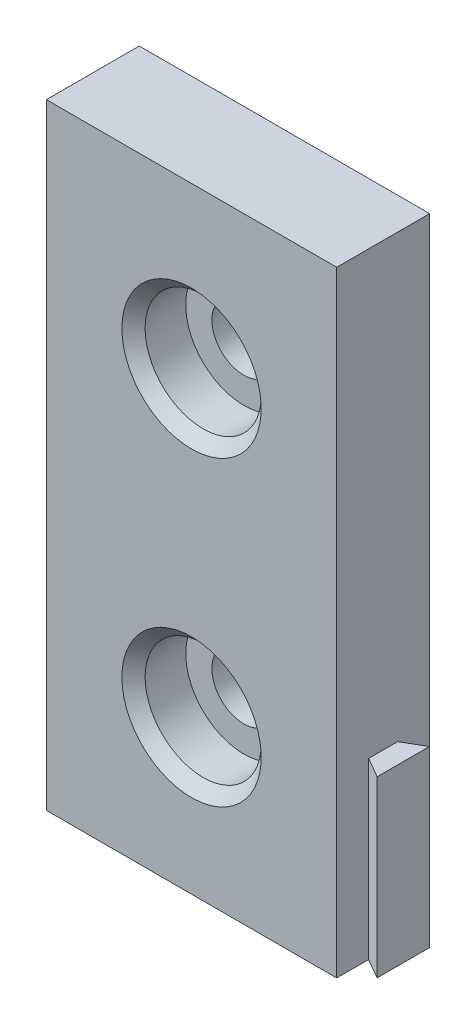
from build123d import *

# Parameters (mm, degrees)
SKETCH2_W           = 25
SKETCH2_H           = 53
SKETCH2_R           = 2.75
BOSS_EXTRUDE1_DEPTH = 8
BOSS_EXTRUDE2_DEPTH = 15
SKETCH4_R           = 5
CUT_EXTRUDE1_DEPTH  = 4.5
CHAMFER1_SIZE       = 1


with BuildPart() as part:
    # Sketch2 → Boss-Extrude1 (new body)
    with BuildSketch(Plane.XY):
        with Locations((12.5, 26.5)):
            Rectangle(SKETCH2_W, SKETCH2_H)
        with Locations((12.5, 39.2)):
            Circle(SKETCH2_R, mode=Mode.SUBTRACT)
        with Locations((12.5, 13.2)):
            Circle(SKETCH2_R, mode=Mode.SUBTRACT)
    extrude(amount=BOSS_EXTRUDE1_DEPTH)

    # Sketch3 → Boss-Extrude2 (add)
    with BuildSketch(Plane.XZ):
        Polygon((25, 2.75), (26.732050808, 1.75), (26.732050808, 6.25), (25, 5.25), align=None)
    extrude(amount=-BOSS_EXTRUDE2_DEPTH)

    # Sketch4 → Cut-Extrude1 (cut)
    with BuildSketch(Plane.XY.offset(8)):
        with Locations((12.5, 39.2)):
            Circle(SKETCH4_R)
        with Locations((12.5, 13.2)):
            Circle(SKETCH4_R)
    extrude(amount=-CUT_EXTRUDE1_DEPTH, mode=Mode.SUBTRACT)

    # Chamfer1
    chamfer1_edges = [part.edges().sort_by_distance(p)[0] for p in [
        (7.5, 39.2, 8),
        (7.5, 13.2, 8),
    ]]
    chamfer(chamfer1_edges, length=CHAMFER1_SIZE)


solid = part.part
